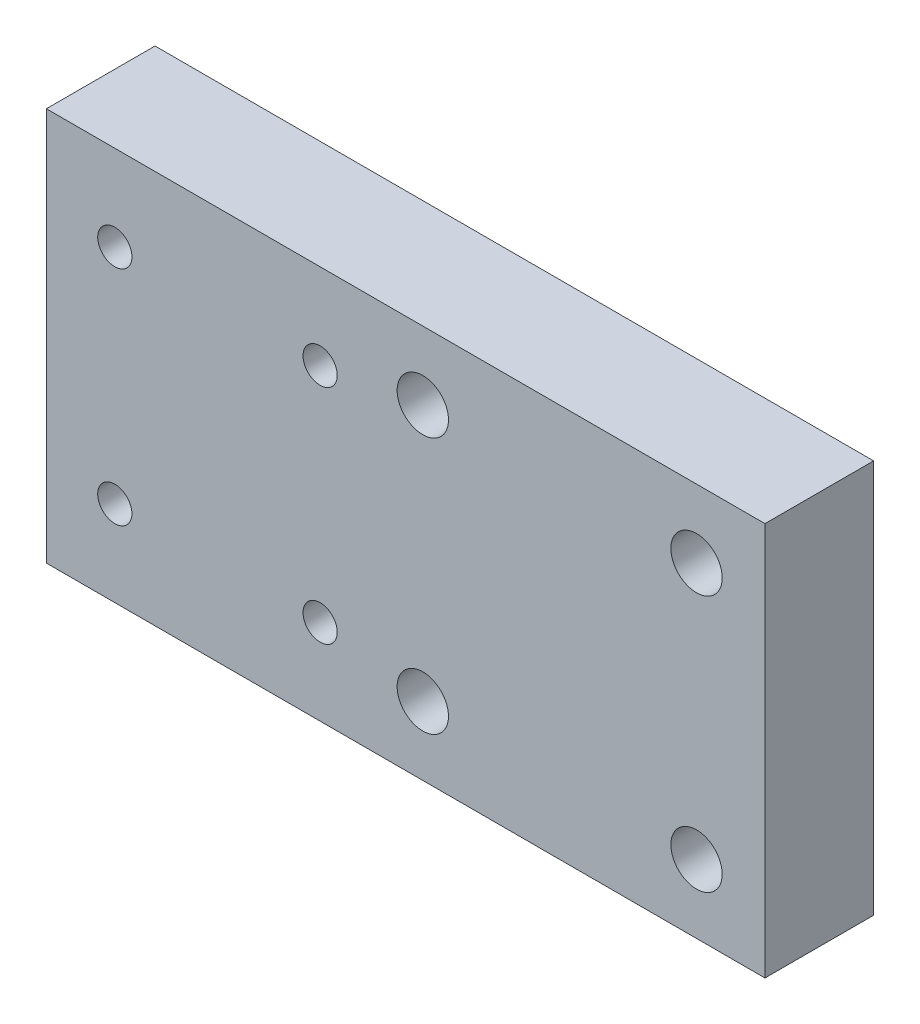
from build123d import *

# Parameters (mm, degrees)
SKETCH1_W           = 42
SKETCH1_H           = 23
SKETCH1_R           = 1.5
SKETCH1_R_2         = 1
BOSS_EXTRUDE1_DEPTH = 6.35


with BuildPart() as part:
    # Sketch1 → Boss-Extrude1 (new body)
    with BuildSketch(Plane.XY):
        with Locations((-9, 0)):
            Rectangle(SKETCH1_W, SKETCH1_H)
        with Locations((-8, 7.5)):
            Circle(SKETCH1_R, mode=Mode.SUBTRACT)
        with Locations((8, 7.5)):
            Circle(SKETCH1_R, mode=Mode.SUBTRACT)
        with Locations((8, -7.5)):
            Circle(SKETCH1_R, mode=Mode.SUBTRACT)
        with Locations((-8, -7.5)):
            Circle(SKETCH1_R, mode=Mode.SUBTRACT)
        with Locations((-26, 6.5)):
            Circle(SKETCH1_R_2, mode=Mode.SUBTRACT)
        with Locations((-14, 6.5)):
            Circle(SKETCH1_R_2, mode=Mode.SUBTRACT)
        with Locations((-14, -6.5)):
            Circle(SKETCH1_R_2, mode=Mode.SUBTRACT)
        with Locations((-26, -6.5)):
            Circle(SKETCH1_R_2, mode=Mode.SUBTRACT)
    extrude(amount=BOSS_EXTRUDE1_DEPTH)


solid = part.part
